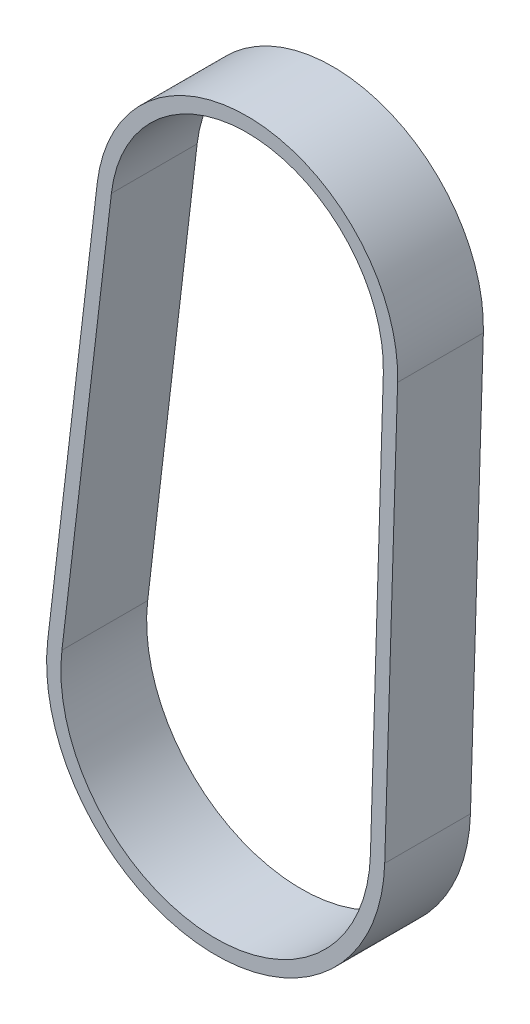
from build123d import *

# Parameters (mm, degrees)
EXTRUDE_THIN1_DEPTH = 9


with BuildPart() as part:
    # Sketch2 → Extrude-Thin1 (new body)
    with BuildSketch(Plane.XY):
        with BuildLine():
            Line((15.816597751, -0.482148399), (14.46320707, -44.879342416))
            ThreePointArc((14.46320707, -44.879342416), (-4.587477971, -62.040180558), (-20.906900785, -42.263947213))
            Line((-20.906900785, -42.263947213), (-15.715494476, 1.849449885))
            ThreePointArc((-15.715494476, 1.849449885), (1.166894642, 15.780861459), (15.816597751, -0.482148399))
        make_face()
        with BuildLine():
            Line((14.317294208, -0.436444081), (12.963903527, -44.833638098))
            ThreePointArc((12.963903527, -44.833638098), (-4.476864469, -60.544264567), (-19.417181129, -42.439262208))
            Line((-19.417181129, -42.439262208), (-14.225774821, 1.674134889))
            ThreePointArc((-14.225774821, 1.674134889), (1.05628114, 14.284945468), (14.317294208, -0.436444081))
        make_face(mode=Mode.SUBTRACT)
    extrude(amount=EXTRUDE_THIN1_DEPTH)


solid = part.part
